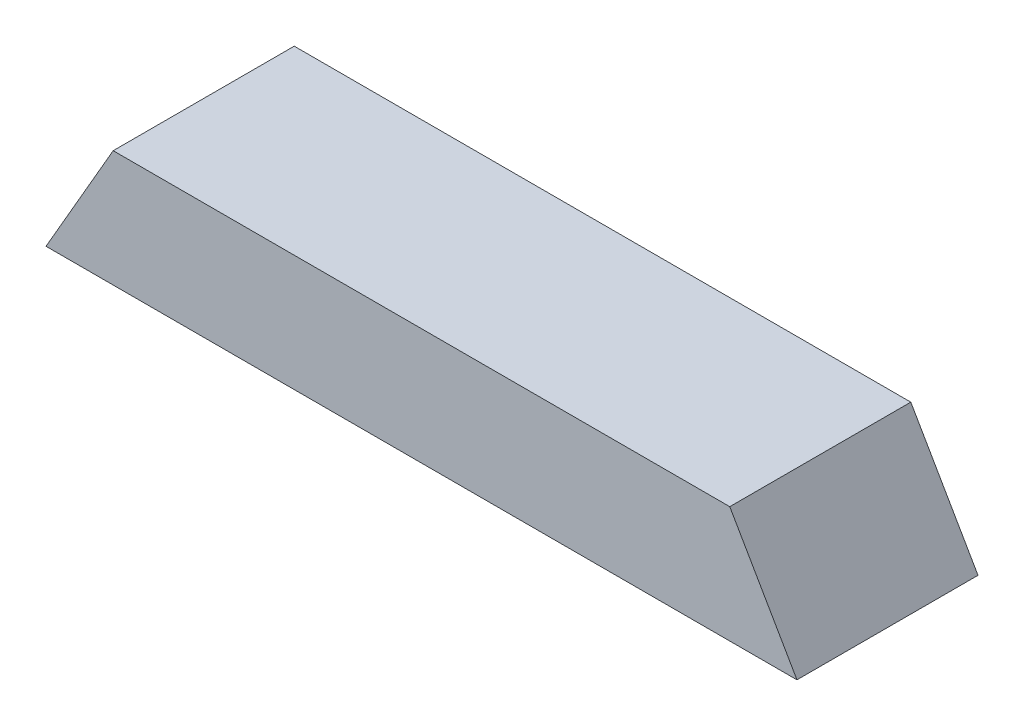
from build123d import *

# Parameters (mm, degrees)
SKETCH1_W           = 26
SKETCH1_H           = 5.6
BOSS_EXTRUDE1_DEPTH = 3.6
CHAMFER1_SIZE       = 6
CHAMFER1_SIZE_2     = 3.464101615


with BuildPart() as part:
    # Sketch1 → Boss-Extrude1 (new body)
    with BuildSketch(Plane(origin=(0, 0, 0), x_dir=(1, 0, 0), z_dir=(0, 1, 0))):
        with Locations((13, 2.8)):
            Rectangle(SKETCH1_W, SKETCH1_H)
    extrude(amount=BOSS_EXTRUDE1_DEPTH)

    # Chamfer1
    # the kernel refuses this chamfer: 6, 3.464101615 mm, written as the material it takes off along each edge
    with BuildSketch(Plane(origin=(0, 3.6, -21.122514528), x_dir=(-0.019326765612700744, -0.9998132206222078, 0), z_dir=(0, 0, 1)), Plane(origin=(26, 3.6, 15.522514528), x_dir=(0.019326765612700865, -0.9998132206222078, 0), z_dir=(0, 0, -1))) as chamfer1_piece_1:
        Polygon((CHAMFER1_SIZE * 0.999813220622, CHAMFER1_SIZE * 0.0193267656127), (-CHAMFER1_SIZE_2 * 0.0193267656135, CHAMFER1_SIZE_2 * 0.999813220662), (0, 0), align=None)
    extrude(amount=36.645029056, mode=Mode.SUBTRACT)


solid = part.part
